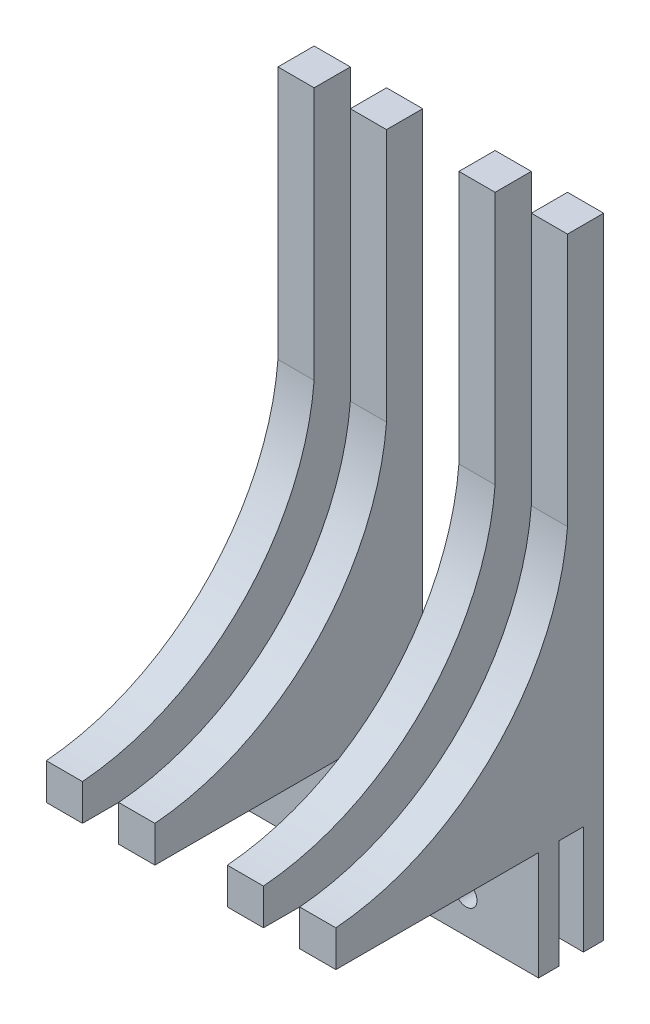
from build123d import *

# Parameters (mm, degrees)
SKETCH1_W            = 9
SKETCH1_H            = 23
BOSS_EXTRUDE1_DEPTH  = 40
BOSS_EXTRUDE2_DEPTH  = 5
LPATTERN1_COUNT      = 2
LPATTERN1_PITCH      = 10
SKETCH6_W            = 40
SKETCH6_H            = 2.8
BOSS_EXTRUDE4_DEPTH  = 15
SKETCH7_W            = 5
SKETCH7_H            = 23
CUT_EXTRUDE1_DEPTH   = 91.293964361
SKETCH8_R            = 1.5
CUT_EXTRUDE2_DEPTH   = 87.994252684
MIRROR1_COPY_1_DEPTH = 5


with BuildPart() as part:
    # Sketch1 → Boss-Extrude1 (new body)
    with BuildSketch(Plane(origin=(0, 0, 0), x_dir=(0, 0, -1), z_dir=(1, 0, 0))):
        with Locations((4.5, 11.5)):
            Rectangle(SKETCH1_W, SKETCH1_H)
    extrude(amount=BOSS_EXTRUDE1_DEPTH)

    # Sketch3 → Boss-Extrude2 (add)
    with BuildSketch(Plane.ZY):
        with BuildLine():
            Line((0, 0), (28, 0))
            Line((28, 0), (28, 5))
            ThreePointArc((28, 5), (6.132470247, 15.132470247), (-4, 37))
            Line((-4, 37), (-4, 72))
            Line((-4, 72), (-9, 72))
            Line((-9, 72), (-9, 37))
            Line((-9, 37), (-9, 23))
            Line((-9, 23), (0, 23))
            Line((0, 23), (0, 0))
        make_face()
    boss_extrude2 = extrude(amount=-BOSS_EXTRUDE2_DEPTH)

    # LPattern1: Boss-Extrude2 ×2
    with Locations(*[(i * LPATTERN1_PITCH, 0, 0) for i in range(1, LPATTERN1_COUNT)]):
        add(boss_extrude2)

    # Sketch6 → Boss-Extrude4 (add)
    with BuildSketch(Plane.XZ):
        with Locations((20, -7.6)):
            Rectangle(SKETCH6_W, SKETCH6_H)
        with Locations((20, -1.4)):
            Rectangle(SKETCH6_W, SKETCH6_H)
    extrude(amount=BOSS_EXTRUDE4_DEPTH)

    # Sketch7 → Cut-Extrude1 (cut, through all)
    with BuildSketch(Plane.XY.offset(28)):
        with Locations((7.5, 11.5)):
            Rectangle(SKETCH7_W, SKETCH7_H)
        with Locations((17.5, 11.5)):
            Rectangle(SKETCH7_W, SKETCH7_H)
    cut_extrude1 = extrude(amount=-CUT_EXTRUDE1_DEPTH, mode=Mode.SUBTRACT)

    # Sketch8 → Cut-Extrude2 (cut, through all)
    with BuildSketch(Plane.XY):
        with Locations((10, -10)):
            Circle(SKETCH8_R)
        with Locations((20, -10)):
            Circle(SKETCH8_R)
        with Locations((30, -10)):
            Circle(SKETCH8_R)
    extrude(amount=-CUT_EXTRUDE2_DEPTH, mode=Mode.SUBTRACT)

    # Mirror1: Boss-Extrude2, Cut-Extrude1 across plane
    add(boss_extrude2.mirror(Plane.ZY.offset(-20)))
    add(cut_extrude1.mirror(Plane.ZY.offset(-20)), mode=Mode.SUBTRACT)

    # Mirror1 copy 1 sketch → Mirror1 copy 1 (add)
    with BuildSketch(Plane(origin=(30, 0, 0), x_dir=(0, 0, 1), z_dir=(1, 0, 0))):
        with BuildLine():
            Line((0, 0), (28, 0))
            Line((28, 0), (28, -5))
            ThreePointArc((28, -5), (6.132470247, -15.132470247), (-4, -37))
            Line((-4, -37), (-4, -72))
            Line((-4, -72), (-9, -72))
            Line((-9, -72), (-9, -37))
            Line((-9, -37), (-9, -23))
            Line((-9, -23), (0, -23))
            Line((0, -23), (0, 0))
        make_face()
    extrude(amount=-MIRROR1_COPY_1_DEPTH)


solid = part.part
